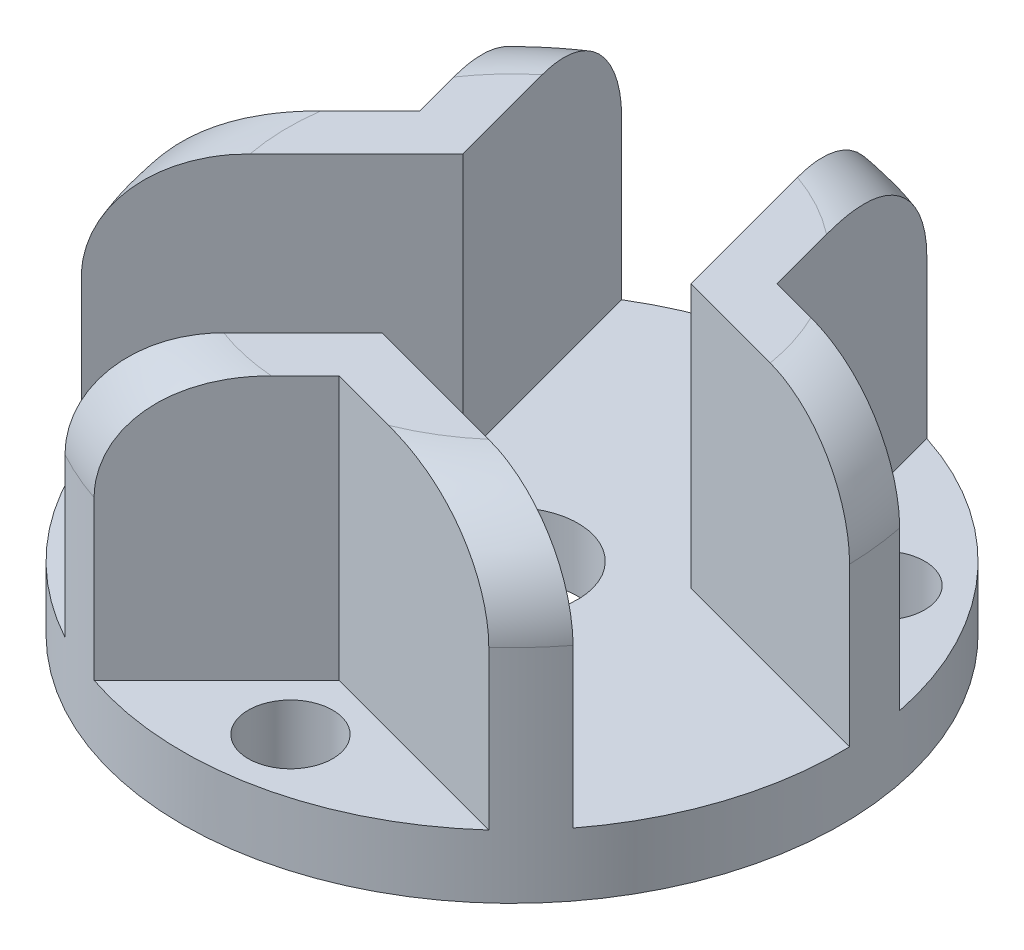
from build123d import *

# Parameters (mm, degrees)
SKETCH1_R           = 62.5
BOSS_EXTRUDE1_DEPTH = 12
BOSS_EXTRUDE2_DEPTH = 50
FILLET1_R           = 20
SKETCH3_R           = 12.5
CUT_EXTRUDE1_DEPTH  = 50
SKETCH4_R           = 8
CUT_EXTRUDE2_DEPTH  = 50


with BuildPart() as part:
    # Sketch1 → Boss-Extrude1 (new body)
    with BuildSketch(Plane(origin=(0, 0, 0), x_dir=(1, 0, 0), z_dir=(0, 1, 0))):
        with Locations(Location((0, 0, 0), (0, 0, 270))):
            Circle(SKETCH1_R)
    extrude(amount=BOSS_EXTRUDE1_DEPTH)

    # Sketch2 → Boss-Extrude2 (add)
    with BuildSketch(Plane(origin=(0, 12, 0), x_dir=(1, 0, 0), z_dir=(0, 1, 0))):
        with BuildLine():
            ThreePointArc((19.168323988, 59.488026993), (13.716019775, 60.976395446), (8.151554557, 61.96613719))
            Line((8.151554557, 61.96613719), (21.395866241, 12.537693074))
            Line((21.395866241, 12.537693074), (62.481297287, 1.528885005))
            ThreePointArc((62.481297287, 1.528885005), (62.119144902, 6.889255161), (61.297971235, 12.198718069))
            Line((61.297971235, 12.198718069), (29.560832051, 20.702658884))
            Line((29.560832051, 20.702658884), (19.168323988, 59.488026993))
        make_face()
        with BuildLine():
            ThreePointArc((41.933980603, -46.344269018), (45.9490976, -42.366619287), (49.588471703, -38.042521922))
            Line((49.588471703, -38.042521922), (0.160027587, -24.798210238))
            Line((0.160027587, -24.798210238), (-29.91659539, -54.874833214))
            ThreePointArc((-29.91659539, -54.874833214), (-25.093302468, -57.241385127), (-20.084585876, -59.184959324))
            Line((-20.084585876, -59.184959324), (3.148612494, -35.951760955))
            Line((3.148612494, -35.951760955), (41.933980603, -46.344269018))
        make_face()
        with BuildLine():
            ThreePointArc((-61.102304591, -13.143757975), (-59.665117375, -18.609776159), (-57.74002626, -23.923615268))
            Line((-57.74002626, -23.923615268), (-21.555893828, 12.260517164))
            Line((-21.555893828, 12.260517164), (-32.564701897, 53.345948209))
            ThreePointArc((-32.564701897, 53.345948209), (-37.025842434, 50.352129966), (-41.213385359, 46.986241255))
            Line((-41.213385359, 46.986241255), (-32.709444544, 15.249102071))
            Line((-32.709444544, 15.249102071), (-61.102304591, -13.143757975))
        make_face()
    extrude(amount=BOSS_EXTRUDE2_DEPTH)

    # Fillet1
    # the kernel refuses this fillet: 20 mm, written as the material it takes off along each edge
    with BuildSketch(Plane(origin=(0, 62, 0), x_dir=(0.24928364261100788, 0, -0.9684305166229467), z_dir=(0.9684305166229467, 0, 0.24928364261100788))) as fillet1_piece_1:
        with BuildLine():
            CenterArc((62.5 - FILLET1_R, -FILLET1_R), FILLET1_R, 0, 90)
            Line((62.5 - FILLET1_R, 0), (62.5, 0))
            Line((62.5, 0), (62.5, -FILLET1_R))
        make_face()
    revolve(axis=Axis((0, 62, 0), (0, 1, 0)), revolution_arc=101.527179198, mode=Mode.SUBTRACT)
    with BuildSketch(Plane(origin=(0, 62, 0), x_dir=(-0.8319838819593003, 0, -0.5547998018744537), z_dir=(0.5547998018744537, 0, -0.8319838819593003))) as fillet1_piece_2:
        with BuildLine():
            CenterArc((62.5 - FILLET1_R, -FILLET1_R), FILLET1_R, 0, 90)
            Line((62.5 - FILLET1_R, 0), (62.5, 0))
            Line((62.5, 0), (62.5, -FILLET1_R))
        make_face()
    revolve(axis=Axis((0, 62, 0), (0, 1, 0)), revolution_arc=102.039649765, mode=Mode.SUBTRACT)
    with BuildSketch(Plane(origin=(0, 62, 0), x_dir=(-0.9633272505010871, 0, 0.26832929106233594), z_dir=(-0.26832929106233594, 0, -0.9633272505010871))) as fillet1_piece_3:
        with BuildLine():
            CenterArc((62.5 - FILLET1_R, -FILLET1_R), FILLET1_R, 0, 90)
            Line((62.5 - FILLET1_R, 0), (62.5, 0))
            Line((62.5, 0), (62.5, -FILLET1_R))
        make_face()
    revolve(axis=Axis((0, 62, 0), (0, 1, 0)), revolution_arc=101.527179198, mode=Mode.SUBTRACT)
    with BuildSketch(Plane(origin=(0, 62, 0), x_dir=(-0.06447878145815908, 0, 0.9979190782531773), z_dir=(-0.9979190782531773, 0, -0.06447878145815908))) as fillet1_piece_4:
        with BuildLine():
            CenterArc((62.5 - FILLET1_R, -FILLET1_R), FILLET1_R, 0, 90)
            Line((62.5 - FILLET1_R, 0), (62.5, 0))
            Line((62.5, 0), (62.5, -FILLET1_R))
        make_face()
    revolve(axis=Axis((0, 62, 0), (0, 1, 0)), revolution_arc=102.039649765, mode=Mode.SUBTRACT)
    with BuildSketch(Plane(origin=(0, 62, 0), x_dir=(0.8964626634174491, 0, -0.443119276378825), z_dir=(0.443119276378825, 0, 0.8964626634174491))) as fillet1_piece_5:
        with BuildLine():
            CenterArc((62.5 - FILLET1_R, -FILLET1_R), FILLET1_R, 0, 90)
            Line((62.5 - FILLET1_R, 0), (62.5, 0))
            Line((62.5, 0), (62.5, -FILLET1_R))
        make_face()
    revolve(axis=Axis((0, 62, 0), (0, 1, 0)), revolution_arc=102.039649765, mode=Mode.SUBTRACT)
    with BuildSketch(Plane(origin=(0, 62, 0), x_dir=(0.7140436078899985, 0, 0.7001012255605856), z_dir=(-0.7001012255605856, 0, 0.7140436078899985))) as fillet1_piece_6:
        with BuildLine():
            CenterArc((62.5 - FILLET1_R, -FILLET1_R), FILLET1_R, 0, 90)
            Line((62.5 - FILLET1_R, 0), (62.5, 0))
            Line((62.5, 0), (62.5, -FILLET1_R))
        make_face()
    revolve(axis=Axis((0, 62, 0), (0, 1, 0)), revolution_arc=101.527179198, mode=Mode.SUBTRACT)

    # Sketch3 → Cut-Extrude1 (cut)
    with BuildSketch(Plane(origin=(0, 12, 0), x_dir=(1, 0, 0), z_dir=(0, 1, 0))):
        with Locations(Location((0, 0, 0), (0, 0, 270))):
            Circle(SKETCH3_R)
    extrude(amount=-CUT_EXTRUDE1_DEPTH, mode=Mode.SUBTRACT)

    # Sketch4 → Cut-Extrude2 (cut)
    with BuildSketch(Plane(origin=(0, 12, 0), x_dir=(1, 0, 0), z_dir=(0, 1, 0))):
        with Locations(Location((39.110778617, 31.150393192, 0), (0, 0, 270))):
            Circle(SKETCH4_R)
        with Locations(Location((7.421642534, -49.44612444, 0), (0, 0, 270))):
            Circle(SKETCH4_R)
        with Locations(Location((-46.53242115, 18.295731248, 0), (0, 0, 270))):
            Circle(SKETCH4_R)
    extrude(amount=-CUT_EXTRUDE2_DEPTH, mode=Mode.SUBTRACT)


solid = part.part
